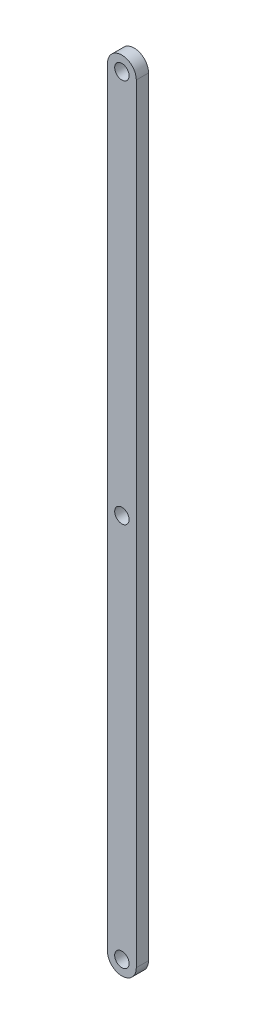
from build123d import *

# Parameters (mm, degrees)
MODEL_R             = 1.5
BOSS_EXTRUDE1_DEPTH = 2.55


with BuildPart() as part:
    # Model → Boss-Extrude1 (new body)
    with BuildSketch(Plane.XY):
        with BuildLine():
            Line((-3, 160), (-3, 0))
            ThreePointArc((-3, 0), (0, -3), (3, 0))
            Line((3, 0), (3, 160))
            ThreePointArc((3, 160), (0, 163), (-3, 160))
        make_face()
        Circle(MODEL_R, mode=Mode.SUBTRACT)
        with Locations((0, 80)):
            Circle(MODEL_R, mode=Mode.SUBTRACT)
        with Locations((0, 160)):
            Circle(MODEL_R, mode=Mode.SUBTRACT)
    extrude(amount=BOSS_EXTRUDE1_DEPTH)


solid = part.part
